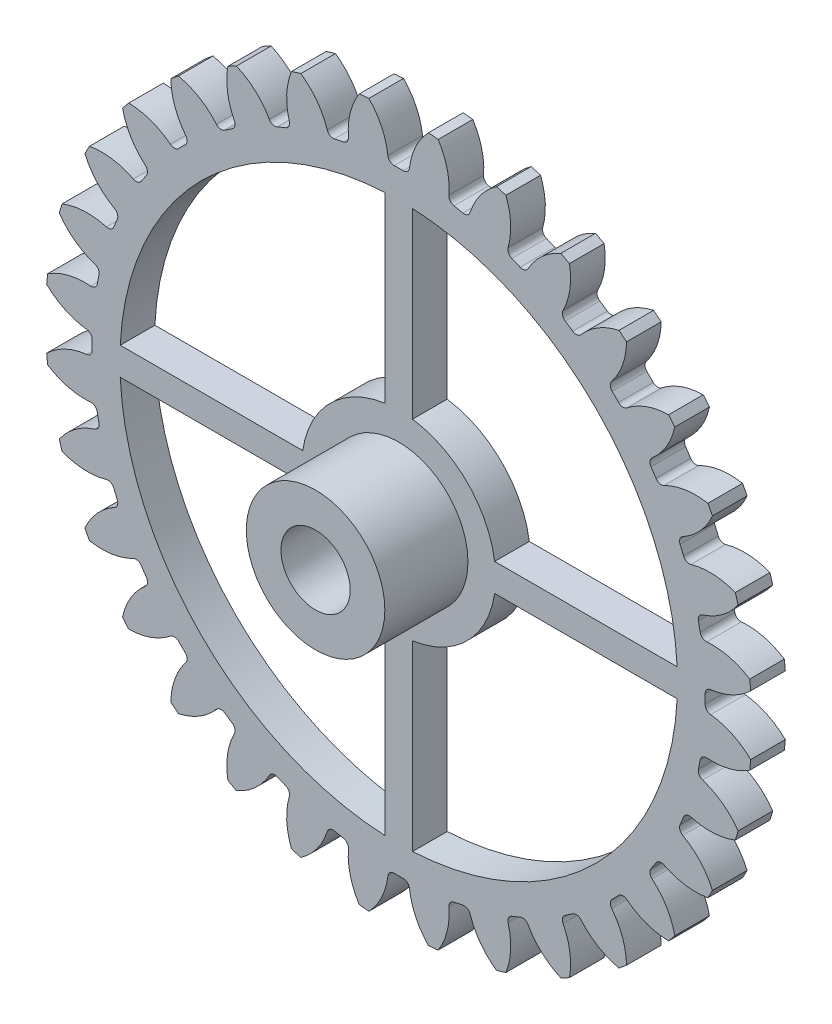
from build123d import *

# Parameters (mm, degrees)
SKETCH1_R                = 51
BOSS_EXTRUDE1_DEPTH      = 2.5
CUT_EXTRUDE1_DEPTH       = 73.168206296
FILLET1_R                = 0.9
CIRPATTERN1_COUNT        = 32
FILLET1_OF_CIRPATTERN1_R = 0.9
SKETCH3_R                = 10
BOSS_EXTRUDE2_DEPTH      = 12
CUT_EXTRUDE2_DEPTH       = 73.863360857
CUT_EXTRUDE2_DEPTH_BACK  = 73.863360857
SKETCH4_R                = 5


with BuildPart() as part:
    # Sketch1 → Boss-Extrude1 (new, symmetric)
    with BuildSketch(Plane.XY):
        Circle(SKETCH1_R)
    extrude(amount=BOSS_EXTRUDE1_DEPTH, both=True)

    # Sketch2 → Cut-Extrude1 (cut, symmetric)
    with BuildSketch(Plane.XY):
        with BuildLine():
            ThreePointArc((-5.306044644, 51.728579047), (-2.572120691, 48.397882413), (-1.498983854, 44.224603417))
            ThreePointArc((-1.498983854, 44.224603417), (0, 44.25), (1.498983854, 44.224603417))
            ThreePointArc((1.498983854, 44.224603417), (2.572120691, 48.397882413), (5.306044644, 51.728579047))
            ThreePointArc((5.306044644, 51.728579047), (0, 52), (-5.306044644, 51.728579047))
        make_face()
    cut_extrude1 = extrude(amount=CUT_EXTRUDE1_DEPTH, both=True, mode=Mode.SUBTRACT)

    # Fillet1
    fillet1_edges = [part.edges().sort_by_distance(p)[0] for p in [
        (1.498983854, 44.224603417, 0),
        (-1.498983854, 44.224603417, 0),
    ]]
    fillet(fillet1_edges, radius=FILLET1_R)

    # CirPattern1: Cut-Extrude1 ×32 about axis
    cirpattern1_axis = Axis((0, 0, 2.5), (0, 0, 1))
    for i in range(1, CIRPATTERN1_COUNT):
        add(cut_extrude1.rotate(cirpattern1_axis, i * 360 / CIRPATTERN1_COUNT), mode=Mode.SUBTRACT)

    # Fillet1 of CirPattern1
    fillet1_of_cirpattern1_edges = [part.edges().sort_by_distance(p)[0] for p in [
        (-7.157610822, 43.667277306, 0),
        (-10.097973421, 43.08240282, 0),
        (-15.539142528, 41.431842217, 0),
        (-18.308903533, 40.284569644, 0),
        (-23.323513702, 37.604204667, 0),
        (-25.81623275, 35.938623048, 0),
        (-30.211575324, 32.33145862, 0),
        (-32.33145862, 30.211575324, 0),
        (-35.938623048, 25.81623275, 0),
        (-37.604204667, 23.323513702, 0),
        (-40.284569644, 18.308903533, 0),
        (-41.431842217, 15.539142528, 0),
        (-43.08240282, 10.097973421, 0),
        (-43.667277306, 7.157610822, 0),
        (-44.224603417, 1.498983854, 0),
        (-44.224603417, -1.498983854, 0),
        (-43.667277306, -7.157610822, 0),
        (-43.08240282, -10.097973421, 0),
        (-41.431842217, -15.539142528, 0),
        (-40.284569644, -18.308903533, 0),
        (-37.604204667, -23.323513702, 0),
        (-35.938623048, -25.81623275, 0),
        (-32.33145862, -30.211575324, 0),
        (-30.211575324, -32.33145862, 0),
        (-25.81623275, -35.938623048, 0),
        (-23.323513702, -37.604204667, 0),
        (-18.308903533, -40.284569644, 0),
        (-15.539142528, -41.431842217, 0),
        (-10.097973421, -43.08240282, 0),
        (-7.157610822, -43.667277306, 0),
        (-1.498983854, -44.224603417, 0),
        (1.498983854, -44.224603417, 0),
        (7.157610822, -43.667277306, 0),
        (10.097973421, -43.08240282, 0),
        (15.539142528, -41.431842217, 0),
        (18.308903533, -40.284569644, 0),
        (23.323513702, -37.604204667, 0),
        (25.81623275, -35.938623048, 0),
        (30.211575324, -32.33145862, 0),
        (32.33145862, -30.211575324, 0),
        (35.938623048, -25.81623275, 0),
        (37.604204667, -23.323513702, 0),
        (40.284569644, -18.308903533, 0),
        (41.431842217, -15.539142528, 0),
        (43.08240282, -10.097973421, 0),
        (43.667277306, -7.157610822, 0),
        (44.224603417, -1.498983854, 0),
        (44.224603417, 1.498983854, 0),
        (43.667277306, 7.157610822, 0),
        (43.08240282, 10.097973421, 0),
        (41.431842217, 15.539142528, 0),
        (40.284569644, 18.308903533, 0),
        (37.604204667, 23.323513702, 0),
        (35.938623048, 25.81623275, 0),
        (32.33145862, 30.211575324, 0),
        (30.211575324, 32.33145862, 0),
        (25.81623275, 35.938623048, 0),
        (23.323513702, 37.604204667, 0),
        (18.308903533, 40.284569644, 0),
        (15.539142528, 41.431842217, 0),
        (10.097973421, 43.08240282, 0),
        (7.157610822, 43.667277306, 0),
    ]]
    fillet(fillet1_of_cirpattern1_edges, radius=FILLET1_OF_CIRPATTERN1_R)

    # Sketch3 → Boss-Extrude2 (add)
    with BuildSketch(Plane.XY.offset(2.5)):
        Circle(SKETCH3_R)
    extrude(amount=BOSS_EXTRUDE2_DEPTH)

    # Sketch4 → Cut-Extrude2 (cut, two sides: drawn at the far end of the back side and taken through both)
    with BuildSketch(Plane.XY.offset(2.5).offset(-CUT_EXTRUDE2_DEPTH_BACK)):
        Circle(SKETCH4_R)
        with BuildLine():
            Line((-2, 13.856406461), (-2, 40.20027985))
            ThreePointArc((-2, 40.20027985), (-28.461047943, 28.461047943), (-40.20027985, 2))
            Line((-40.20027985, 2), (-13.856406461, 2))
            ThreePointArc((-13.856406461, 2), (-9.899494937, 9.899494937), (-2, 13.856406461))
        make_face()
        with BuildLine():
            Line((2, 13.856406461), (2, 40.20027985))
            ThreePointArc((2, 40.20027985), (28.461047943, 28.461047943), (40.20027985, 2))
            Line((40.20027985, 2), (13.856406461, 2))
            ThreePointArc((13.856406461, 2), (9.899494937, 9.899494937), (2, 13.856406461))
        make_face()
        with BuildLine():
            Line((13.856406461, -2), (40.20027985, -2))
            ThreePointArc((40.20027985, -2), (28.461047943, -28.461047943), (2, -40.20027985))
            Line((2, -40.20027985), (2, -13.856406461))
            ThreePointArc((2, -13.856406461), (9.899494937, -9.899494937), (13.856406461, -2))
        make_face()
        with BuildLine():
            Line((-2, -13.856406461), (-2, -40.20027985))
            ThreePointArc((-2, -40.20027985), (-28.461047943, -28.461047943), (-40.20027985, -2))
            Line((-40.20027985, -2), (-13.856406461, -2))
            ThreePointArc((-13.856406461, -2), (-9.899494937, -9.899494937), (-2, -13.856406461))
        make_face()
    extrude(amount=CUT_EXTRUDE2_DEPTH + CUT_EXTRUDE2_DEPTH_BACK, mode=Mode.SUBTRACT)


solid = part.part
